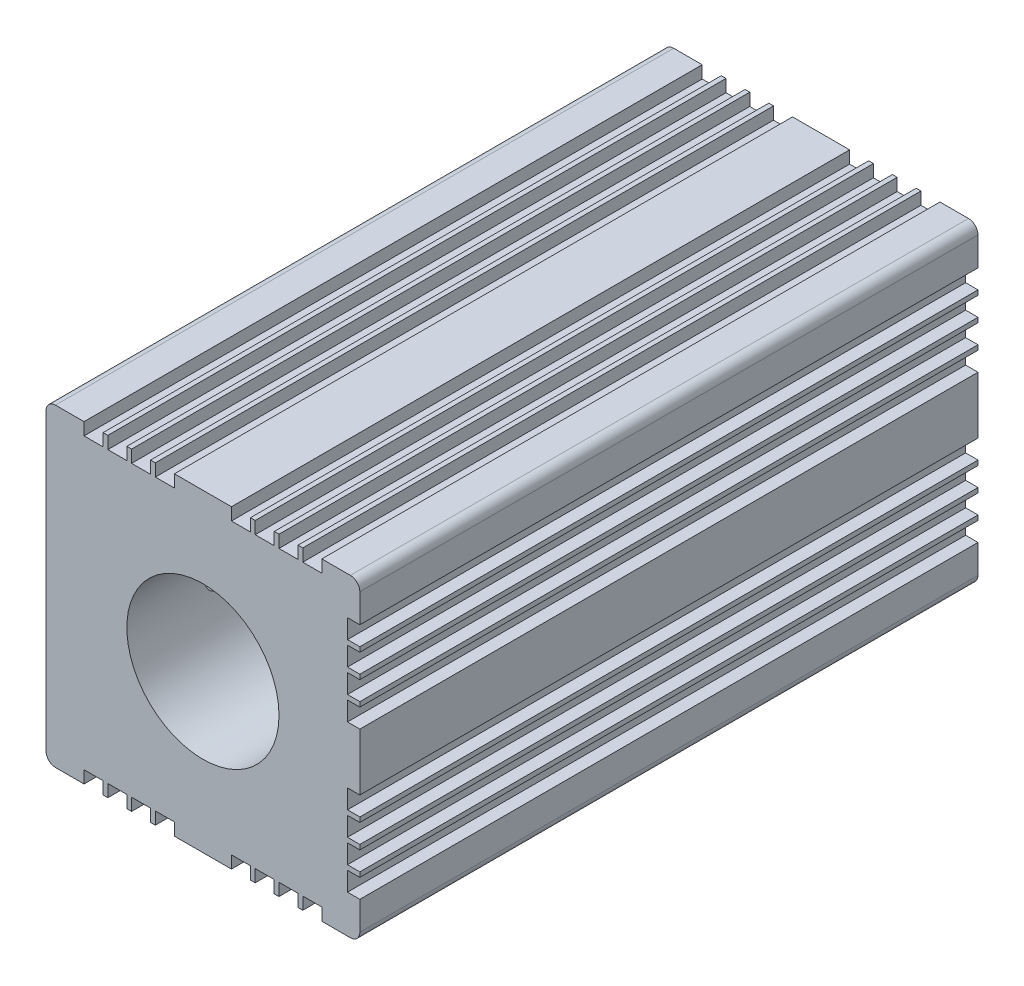
from build123d import *

# Parameters (mm, degrees)
SKETCH1_W                   = 33
SKETCH1_H                   = 33
BOSS_EXTRUDE1_DEPTH         = 65
FILLET1_R                   = 1
CUT_EXTRUDE2_START          = -30
CUT_EXTRUDE2_OUTLINE_R      = 8
CUT_EXTRUDE2_DEPTH          = 30
TAP_DRILL_FOR_M3_TAP1_D     = 2.5
TAP_DRILL_FOR_M3_TAP1_DEPTH = 20
TAP_DRILL_FOR_M3_TAP1_TIP   = 0.751075774
CUT_EXTRUDE5_REACH          = 82.019
SKETCH6_W                   = 2
SKETCH6_H                   = 1.3
CIRPATTERN1_COUNT           = 3
CIRPATTERN1_ANGLE           = 180
CIRPATTERN1_COPY_1_REACH    = 82.019
CIRPATTERN1_COPY_1_SKETCH_W = 2
CIRPATTERN1_COPY_1_SKETCH_H = 1.3
CIRPATTERN1_COPY_2_REACH    = 82.019
CIRPATTERN1_COPY_2_SKETCH_W = 2
CIRPATTERN1_COPY_2_SKETCH_H = 1.3


# Read off the part's stored shape, not the designer's step: Cut-Extrude2
with BuildPart() as part:
    # Sketch1 → Boss-Extrude1 (new body)
    with BuildSketch(Plane.XY):
        with Locations((16.5, 16.5)):
            Rectangle(SKETCH1_W, SKETCH1_H)
    extrude(amount=BOSS_EXTRUDE1_DEPTH)

    # Fillet1
    fillet1_edges = [part.edges().sort_by_distance(p)[0] for p in [
        (0, 33, 32.5),
        (33, 33, 32.5),
        (33, 0, 32.5),
        (0, 0, 32.5),
    ]]
    fillet(fillet1_edges, radius=FILLET1_R)

    # Cut-Extrude2 outline → Cut-Extrude2 (cut)
    with BuildSketch(Plane.XY.offset(65).offset(CUT_EXTRUDE2_START)):
        with Locations((16.5, 16.5)):
            Circle(CUT_EXTRUDE2_OUTLINE_R)
    extrude(amount=CUT_EXTRUDE2_DEPTH, mode=Mode.SUBTRACT)

    # Tap Drill for M3 Tap1
    with Locations(Plane(origin=(0, 0, 0), x_dir=(0, -1, 0), z_dir=(-1, 0, 0))):
        with Locations((-16.5, 55.5), (-16.5, 48), (-16.5, 30.5), (-16.5, 18)):
            Hole(TAP_DRILL_FOR_M3_TAP1_D / 2, depth=TAP_DRILL_FOR_M3_TAP1_DEPTH)
            with Locations((0, 0, -(TAP_DRILL_FOR_M3_TAP1_DEPTH + TAP_DRILL_FOR_M3_TAP1_TIP / 2))):  # 118° drill point
                Cone(0, TAP_DRILL_FOR_M3_TAP1_D / 2, TAP_DRILL_FOR_M3_TAP1_TIP, mode=Mode.SUBTRACT)

    # Sketch6 → Cut-Extrude5 (cut, up to next)
    with BuildSketch(Plane.XY.offset(65), mode=Mode.PRIVATE) as cut_extrude5_sk1:
        with Locations((5, 32.35)):
            Rectangle(SKETCH6_W, SKETCH6_H)
    cut_extrude5_tool1 = extrude(cut_extrude5_sk1.sketch, amount=-CUT_EXTRUDE5_REACH, mode=Mode.PRIVATE) & part.part
    # Sketch6 → Cut-Extrude5 (cut, up to next)
    with BuildSketch(Plane.XY.offset(65), mode=Mode.PRIVATE) as cut_extrude5_sk2:
        with Locations((7.5, 32.35)):
            Rectangle(SKETCH6_W, SKETCH6_H)
    cut_extrude5_tool2 = extrude(cut_extrude5_sk2.sketch, amount=-CUT_EXTRUDE5_REACH, mode=Mode.PRIVATE) & part.part
    # Sketch6 → Cut-Extrude5 (cut, up to next)
    with BuildSketch(Plane.XY.offset(65), mode=Mode.PRIVATE) as cut_extrude5_sk3:
        with Locations((10, 32.35)):
            Rectangle(SKETCH6_W, SKETCH6_H)
    cut_extrude5_tool3 = extrude(cut_extrude5_sk3.sketch, amount=-CUT_EXTRUDE5_REACH, mode=Mode.PRIVATE) & part.part
    # Sketch6 → Cut-Extrude5 (cut, up to next)
    with BuildSketch(Plane.XY.offset(65), mode=Mode.PRIVATE) as cut_extrude5_sk4:
        with Locations((12.5, 32.35)):
            Rectangle(SKETCH6_W, SKETCH6_H)
    cut_extrude5_tool4 = extrude(cut_extrude5_sk4.sketch, amount=-CUT_EXTRUDE5_REACH, mode=Mode.PRIVATE) & part.part
    cut_extrude5_1 = cut_extrude5_tool1.solids().sort_by_distance((5, 32.35, 65))[0]
    add(cut_extrude5_1, mode=Mode.SUBTRACT)
    cut_extrude5_2 = cut_extrude5_tool2.solids().sort_by_distance((7.5, 32.35, 65))[0]
    add(cut_extrude5_2, mode=Mode.SUBTRACT)
    cut_extrude5_3 = cut_extrude5_tool3.solids().sort_by_distance((10, 32.35, 65))[0]
    add(cut_extrude5_3, mode=Mode.SUBTRACT)
    cut_extrude5_4 = cut_extrude5_tool4.solids().sort_by_distance((12.5, 32.35, 65))[0]
    add(cut_extrude5_4, mode=Mode.SUBTRACT)
    cut_extrude5 = cut_extrude5_1 + cut_extrude5_2 + cut_extrude5_3 + cut_extrude5_4  # Cut-Extrude5 as one shape, for the pattern or mirror that repeats it

    # Mirror2: Cut-Extrude5 across plane
    add(cut_extrude5.mirror(Plane(origin=(16.5, 0, 0), x_dir=(0, 0, 1), z_dir=(1, 0, 0))), mode=Mode.SUBTRACT)

    # CirPattern1: Cut-Extrude5 ×3 about axis
    cirpattern1_axis = Axis((16.5, 16.5, 0), (0, 0, -1))
    for i in range(1, CIRPATTERN1_COUNT):
        add(cut_extrude5.rotate(cirpattern1_axis, i * CIRPATTERN1_ANGLE / (CIRPATTERN1_COUNT - 1)), mode=Mode.SUBTRACT)

    # CirPattern1 copy 1 sketch → CirPattern1 copy 1 (cut, up to next)
    with BuildSketch(Plane(origin=(0, 0, 65), x_dir=(0, 1, 0), z_dir=(0, 0, 1)), mode=Mode.PRIVATE) as cirpattern1_copy_1_sk1:
        with Locations((5, -32.35)):
            Rectangle(CIRPATTERN1_COPY_1_SKETCH_W, CIRPATTERN1_COPY_1_SKETCH_H)
    cirpattern1_copy_1_tool1 = extrude(cirpattern1_copy_1_sk1.sketch, amount=-CIRPATTERN1_COPY_1_REACH, mode=Mode.PRIVATE) & part.part
    # CirPattern1 copy 1 sketch → CirPattern1 copy 1 (cut, up to next)
    with BuildSketch(Plane(origin=(0, 0, 65), x_dir=(0, 1, 0), z_dir=(0, 0, 1)), mode=Mode.PRIVATE) as cirpattern1_copy_1_sk2:
        with Locations((7.5, -32.35)):
            Rectangle(CIRPATTERN1_COPY_1_SKETCH_W, CIRPATTERN1_COPY_1_SKETCH_H)
    cirpattern1_copy_1_tool2 = extrude(cirpattern1_copy_1_sk2.sketch, amount=-CIRPATTERN1_COPY_1_REACH, mode=Mode.PRIVATE) & part.part
    # CirPattern1 copy 1 sketch → CirPattern1 copy 1 (cut, up to next)
    with BuildSketch(Plane(origin=(0, 0, 65), x_dir=(0, 1, 0), z_dir=(0, 0, 1)), mode=Mode.PRIVATE) as cirpattern1_copy_1_sk3:
        with Locations((10, -32.35)):
            Rectangle(CIRPATTERN1_COPY_1_SKETCH_W, CIRPATTERN1_COPY_1_SKETCH_H)
    cirpattern1_copy_1_tool3 = extrude(cirpattern1_copy_1_sk3.sketch, amount=-CIRPATTERN1_COPY_1_REACH, mode=Mode.PRIVATE) & part.part
    # CirPattern1 copy 1 sketch → CirPattern1 copy 1 (cut, up to next)
    with BuildSketch(Plane(origin=(0, 0, 65), x_dir=(0, 1, 0), z_dir=(0, 0, 1)), mode=Mode.PRIVATE) as cirpattern1_copy_1_sk4:
        with Locations((12.5, -32.35)):
            Rectangle(CIRPATTERN1_COPY_1_SKETCH_W, CIRPATTERN1_COPY_1_SKETCH_H)
    cirpattern1_copy_1_tool4 = extrude(cirpattern1_copy_1_sk4.sketch, amount=-CIRPATTERN1_COPY_1_REACH, mode=Mode.PRIVATE) & part.part
    add(cirpattern1_copy_1_tool1.solids().sort_by_distance((32.35, 5, 65))[0], mode=Mode.SUBTRACT)
    add(cirpattern1_copy_1_tool2.solids().sort_by_distance((32.35, 7.5, 65))[0], mode=Mode.SUBTRACT)
    add(cirpattern1_copy_1_tool3.solids().sort_by_distance((32.35, 10, 65))[0], mode=Mode.SUBTRACT)
    add(cirpattern1_copy_1_tool4.solids().sort_by_distance((32.35, 12.5, 65))[0], mode=Mode.SUBTRACT)

    # CirPattern1 copy 2 sketch → CirPattern1 copy 2 (cut, up to next)
    with BuildSketch(Plane(origin=(0, 33, 65), x_dir=(1, 0, 0), z_dir=(0, 0, 1)), mode=Mode.PRIVATE) as cirpattern1_copy_2_sk1:
        with Locations((5, -32.35)):
            Rectangle(CIRPATTERN1_COPY_2_SKETCH_W, CIRPATTERN1_COPY_2_SKETCH_H)
    cirpattern1_copy_2_tool1 = extrude(cirpattern1_copy_2_sk1.sketch, amount=-CIRPATTERN1_COPY_2_REACH, mode=Mode.PRIVATE) & part.part
    # CirPattern1 copy 2 sketch → CirPattern1 copy 2 (cut, up to next)
    with BuildSketch(Plane(origin=(0, 33, 65), x_dir=(1, 0, 0), z_dir=(0, 0, 1)), mode=Mode.PRIVATE) as cirpattern1_copy_2_sk2:
        with Locations((7.5, -32.35)):
            Rectangle(CIRPATTERN1_COPY_2_SKETCH_W, CIRPATTERN1_COPY_2_SKETCH_H)
    cirpattern1_copy_2_tool2 = extrude(cirpattern1_copy_2_sk2.sketch, amount=-CIRPATTERN1_COPY_2_REACH, mode=Mode.PRIVATE) & part.part
    # CirPattern1 copy 2 sketch → CirPattern1 copy 2 (cut, up to next)
    with BuildSketch(Plane(origin=(0, 33, 65), x_dir=(1, 0, 0), z_dir=(0, 0, 1)), mode=Mode.PRIVATE) as cirpattern1_copy_2_sk3:
        with Locations((10, -32.35)):
            Rectangle(CIRPATTERN1_COPY_2_SKETCH_W, CIRPATTERN1_COPY_2_SKETCH_H)
    cirpattern1_copy_2_tool3 = extrude(cirpattern1_copy_2_sk3.sketch, amount=-CIRPATTERN1_COPY_2_REACH, mode=Mode.PRIVATE) & part.part
    # CirPattern1 copy 2 sketch → CirPattern1 copy 2 (cut, up to next)
    with BuildSketch(Plane(origin=(0, 33, 65), x_dir=(1, 0, 0), z_dir=(0, 0, 1)), mode=Mode.PRIVATE) as cirpattern1_copy_2_sk4:
        with Locations((12.5, -32.35)):
            Rectangle(CIRPATTERN1_COPY_2_SKETCH_W, CIRPATTERN1_COPY_2_SKETCH_H)
    cirpattern1_copy_2_tool4 = extrude(cirpattern1_copy_2_sk4.sketch, amount=-CIRPATTERN1_COPY_2_REACH, mode=Mode.PRIVATE) & part.part
    add(cirpattern1_copy_2_tool1.solids().sort_by_distance((5, 0.65, 65))[0], mode=Mode.SUBTRACT)
    add(cirpattern1_copy_2_tool2.solids().sort_by_distance((7.5, 0.65, 65))[0], mode=Mode.SUBTRACT)
    add(cirpattern1_copy_2_tool3.solids().sort_by_distance((10, 0.65, 65))[0], mode=Mode.SUBTRACT)
    add(cirpattern1_copy_2_tool4.solids().sort_by_distance((12.5, 0.65, 65))[0], mode=Mode.SUBTRACT)


solid = part.part
